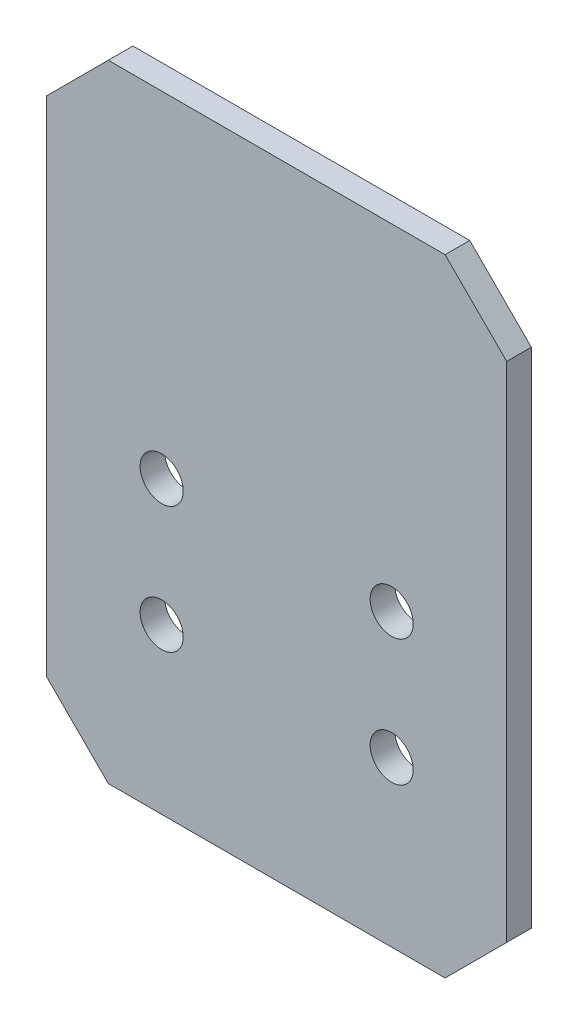
from build123d import *

# Parameters (mm, degrees)
SKETCH_1_R             = 5.25
SM_BASE_FLANGE_1_DEPTH = 6


# Sheet-metal steps are written as plain solids
with BuildPart() as part:
    # Sketch 1 → Базовая кромка1 (new body)
    with BuildSketch(Plane.XY):
        Polygon((-41, -132.5), (-56, -117.5), (-56, 5), (-41, 20), (41, 20), (56, 5), (56, -117.5), (41, -132.5), align=None)
        with Locations((28, -61.72618932)):
            Circle(SKETCH_1_R, mode=Mode.SUBTRACT)
        with Locations((28, -92.5)):
            Circle(SKETCH_1_R, mode=Mode.SUBTRACT)
        with Locations((-28, -92.5)):
            Circle(SKETCH_1_R, mode=Mode.SUBTRACT)
        with Locations((-28, -61.72618932)):
            Circle(SKETCH_1_R, mode=Mode.SUBTRACT)
    extrude(amount=-SM_BASE_FLANGE_1_DEPTH)


solid = part.part
